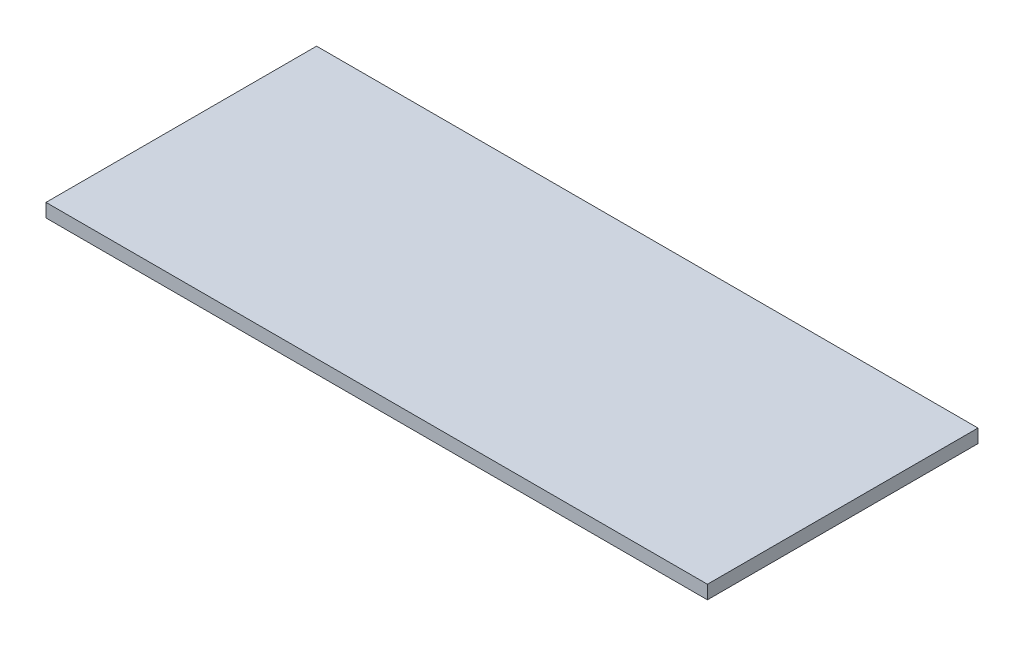
from build123d import *

# Parameters (mm, degrees)
SKETCH2_W           = 220
SKETCH2_H           = 90
BOSS_EXTRUDE1_DEPTH = 4.5


with BuildPart() as part:
    # Sketch2 → Boss-Extrude1 (new body)
    with BuildSketch(Plane(origin=(0, 0, 0), x_dir=(1, 0, 0), z_dir=(0, 1, 0))):
        Rectangle(SKETCH2_W, SKETCH2_H)
    extrude(amount=BOSS_EXTRUDE1_DEPTH)


solid = part.part
